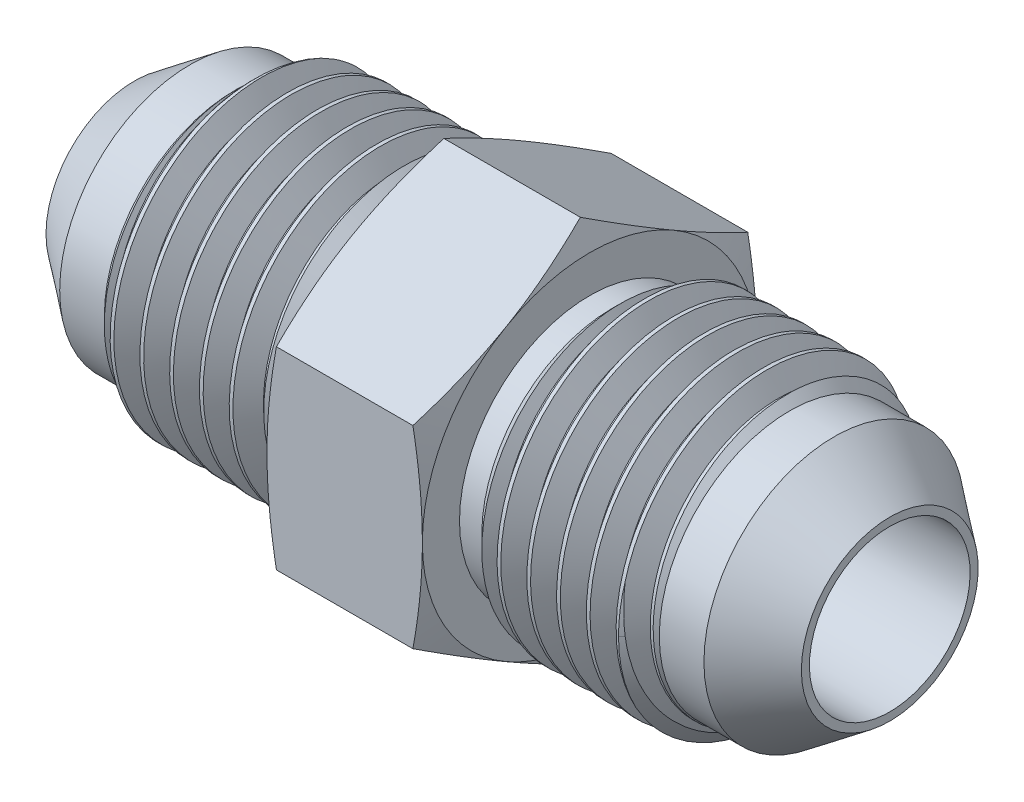
from build123d import *

# Parameters (mm, degrees)
SKETCH6_W          = 35.814
SKETCH6_H          = 7.14375
CUT_SWEEP1_PITCH   = 1.411111111
EXTRUDE1_DEPTH     = 7.366
SKETCH7_W          = 35.814
SKETCH7_H          = 3.81
SKETCH16_OUTSIDE_W = 168.086
SKETCH16_OUTSIDE_H = 170.54
SKETCH16_OUTSIDE_R = 7.9375
CUT_EXTRUDE1_DEPTH = 25.761607674
CUT_EXTRUDE1_DRAFT = -70
SKETCH17_OUTSIDE_W = 168.086
SKETCH17_OUTSIDE_H = 170.54
SKETCH17_OUTSIDE_R = 7.9375
CUT_EXTRUDE2_DEPTH = 25.761607674
CUT_EXTRUDE2_DRAFT = -70


with BuildPart() as part:
    # Sketch6 → Revolve3 (revolve)
    with BuildSketch(Plane.XY, mode=Mode.PRIVATE) as revolve3_sk:
        with Locations((0, 3.571875)):
            Rectangle(SKETCH6_W, SKETCH6_H)
    revolve(revolve3_sk.sketch.rotate(Axis((-17.907, 0, 0), (1, 0, 0)), 90), axis=Axis((-17.907, 0, 0), (1, 0, 0)))

    # Cut-Sweep1: the profile of Sketch15 profile screwed along a right-hand helix of 26.38 turns, 8 arcs to a turn; built about Z, then put on its axis
    cut_sweep1_z = Axis((0, 0, 0), (0, 0, 1))
    cut_sweep1_corners = [(7.14405, 0, -1.234895427), (7.14405, 0, 0.000173205), (6.227206448, 0, -0.529166667), (6.227206448, 0, -0.705555556)]
    with BuildLine(mode=Mode.PRIVATE) as cut_sweep1_profile:
        Line(cut_sweep1_corners[0], cut_sweep1_corners[1])
        Line(cut_sweep1_corners[1], cut_sweep1_corners[2])
        Line(cut_sweep1_corners[2], cut_sweep1_corners[3])
        Line(cut_sweep1_corners[3], cut_sweep1_corners[0])
    cut_sweep1_cap = Face(cut_sweep1_profile.wire())
    cut_sweep1_turn_angles = [0, 22.5, 45, 67.5, 90, 112.5, 135, 157.5, 180, 202.5, 225, 247.5, 270, 292.5, 315, 337.5, 360]
    cut_sweep1_turn_weights = [1, 0.9238795325112867, 1, 0.9238795325112867, 1, 0.9238795325112867, 1, 0.9238795325112867, 1, 0.9238795325112867, 1, 0.9238795325112867, 1, 0.9238795325112867, 1, 0.9238795325112867, 1]
    cut_sweep1_turn_rails = [Edge.make_bspline([Vector(p[0], p[1], 0).rotate(cut_sweep1_z, cut_sweep1_turn_angles[k]) / cut_sweep1_turn_weights[k] + Vector(0, 0, p[2] + CUT_SWEEP1_PITCH * cut_sweep1_turn_angles[k] / 360) for k in range(17)], [0, 0, 0, 1, 1, 2, 2, 3, 3, 4, 4, 5, 5, 6, 6, 7, 7, 8, 8, 8], 2, cut_sweep1_turn_weights) for p in cut_sweep1_corners]
    cut_sweep1_turn_sides = [Face.make_surface_from_curves(cut_sweep1_turn_rails[p[0]], cut_sweep1_turn_rails[p[1]]) for p in [(0, 1), (1, 2), (2, 3), (3, 0)]]
    cut_sweep1_last_angles = [9360, 9382.5, 9405, 9427.5, 9450, 9472.5, 9495, 9495.9, 9496.8]
    cut_sweep1_last_weights = [1, 0.9238795325112867, 1, 0.9238795325112867, 1, 0.9238795325112867, 1, 0.9998766324816469, 1]
    cut_sweep1_last_rails = [Edge.make_bspline([Vector(p[0], p[1], 0).rotate(cut_sweep1_z, cut_sweep1_last_angles[k]) / cut_sweep1_last_weights[k] + Vector(0, 0, p[2] + CUT_SWEEP1_PITCH * cut_sweep1_last_angles[k] / 360) for k in range(9)], [0, 0, 0, 1, 1, 2, 2, 3, 3, 4, 4, 4], 2, cut_sweep1_last_weights) for p in cut_sweep1_corners]
    cut_sweep1_last_sides = [Face.make_surface_from_curves(cut_sweep1_last_rails[p[0]], cut_sweep1_last_rails[p[1]]) for p in [(0, 1), (1, 2), (2, 3), (3, 0)]]
    cut_sweep1 = Plane(origin=(-17.907, 0, 0), x_dir=(0, 1, 0), z_dir=(1, 0, 0)) * Solid(Shell([*[p.moved(Location((0, 0, CUT_SWEEP1_PITCH * i))) for i in range(26) for p in cut_sweep1_turn_sides], *cut_sweep1_last_sides, cut_sweep1_cap, cut_sweep1_cap.rotate(cut_sweep1_z, 9496.8).moved(Location((0, 0, CUT_SWEEP1_PITCH * 9496.8 / 360)))]))
    add(cut_sweep1, mode=Mode.SUBTRACT)

    # Sketch12 → Extrude1 (add)
    with BuildSketch(Plane(origin=(-3.683, 0, 0), x_dir=(0, 0, -1), z_dir=(1, 0, 0))):
        Polygon((0, 9.165435523), (-7.9375, 4.582717762), (-7.9375, -4.582717762), (0, -9.165435523), (7.9375, -4.582717762), (7.9375, 4.582717762), align=None)
    extrude(amount=EXTRUDE1_DEPTH)

    # Sketch7 → Cut-Revolve5 (revolve, cut)
    with BuildSketch(Plane.XY):
        with Locations((0, 1.905)):
            Rectangle(SKETCH7_W, SKETCH7_H)
    revolve(axis=Axis((17.907, 0, 0), (-1, 0, 0)), mode=Mode.SUBTRACT)

    # Sketch10 → Cut-Revolve6 (revolve, cut)
    with BuildSketch(Plane.XY, mode=Mode.PRIVATE) as cut_revolve6_sk:
        Polygon((-17.907, 7.14375), (-17.907, 4.191), (-15.272276655, 6.176406448), (-13.155609988, 6.176406448), (-12.188266436, 7.14375), align=None)
        Polygon((-5.708676886, 7.14375), (-3.683, 7.14375), (-3.683, 6.176406448), (-4.741333333, 6.176406448), align=None)
        Polygon((4.741333333, 6.176406448), (5.708676886, 7.14375), (3.683, 7.14375), (3.683, 6.176406448), align=None)
        Polygon((12.188266436, 7.14375), (17.907, 7.14375), (17.907, 4.191), (15.272276655, 6.176406448), (13.155609988, 6.176406448), align=None)
    revolve(cut_revolve6_sk.sketch.rotate(Axis((-17.907, 0, 0), (1, 0, 0)), 90), axis=Axis((-17.907, 0, 0), (1, 0, 0)), mode=Mode.SUBTRACT)


with BuildPart() as cut_extrude1_tool:
    # Sketch16 outside → Cut-Extrude1 (with draft: the straight prism first)
    with BuildSketch(Plane.ZY.offset(3.683)):
        Rectangle(SKETCH16_OUTSIDE_W, SKETCH16_OUTSIDE_H)
        Circle(SKETCH16_OUTSIDE_R, mode=Mode.SUBTRACT)
    extrude(amount=-CUT_EXTRUDE1_DEPTH)
    # Cut-Extrude1: the draft: its side faces are tilted about the plane it starts from
    cut_extrude1_sides = [cut_extrude1_tool.faces().sort_by_distance(p)[0] for p in [
        (9.197803837, -85.27, 0),
        (9.197803837, 0, 84.043),
        (9.197803837, 85.27, 0),
        (9.197803837, 0, -84.043),
        (9.197803837, 0, -7.9375),
    ]]
    draft(cut_extrude1_sides, Plane.ZY.offset(3.683), CUT_EXTRUDE1_DRAFT)


with BuildPart() as part_1:
    add(part.part)

    # Cut-Extrude1: cut by cut_extrude1_tool
    add(cut_extrude1_tool.part, mode=Mode.SUBTRACT)


with BuildPart() as cut_extrude2_tool:
    # Sketch17 outside → Cut-Extrude2 (with draft: the straight prism first)
    with BuildSketch(Plane(origin=(3.683, 0, 0), x_dir=(0, 0, -1), z_dir=(1, 0, 0))):
        Rectangle(SKETCH17_OUTSIDE_W, SKETCH17_OUTSIDE_H)
        Circle(SKETCH17_OUTSIDE_R, mode=Mode.SUBTRACT)
    extrude(amount=-CUT_EXTRUDE2_DEPTH)
    # Cut-Extrude2: the draft: its side faces are tilted about the plane it starts from
    cut_extrude2_sides = [cut_extrude2_tool.faces().sort_by_distance(p)[0] for p in [
        (-9.197803837, -85.27, 0),
        (-9.197803837, 0, -84.043),
        (-9.197803837, 85.27, 0),
        (-9.197803837, 0, 84.043),
        (-9.197803837, 0, 7.9375),
    ]]
    draft(cut_extrude2_sides, Plane(origin=(3.683, 0, 0), x_dir=(0, 0, -1), z_dir=(1, 0, 0)), CUT_EXTRUDE2_DRAFT)


with BuildPart() as part_2:
    add(part_1.part)

    # Cut-Extrude2: cut by cut_extrude2_tool
    add(cut_extrude2_tool.part, mode=Mode.SUBTRACT)


solid = part_2.part
